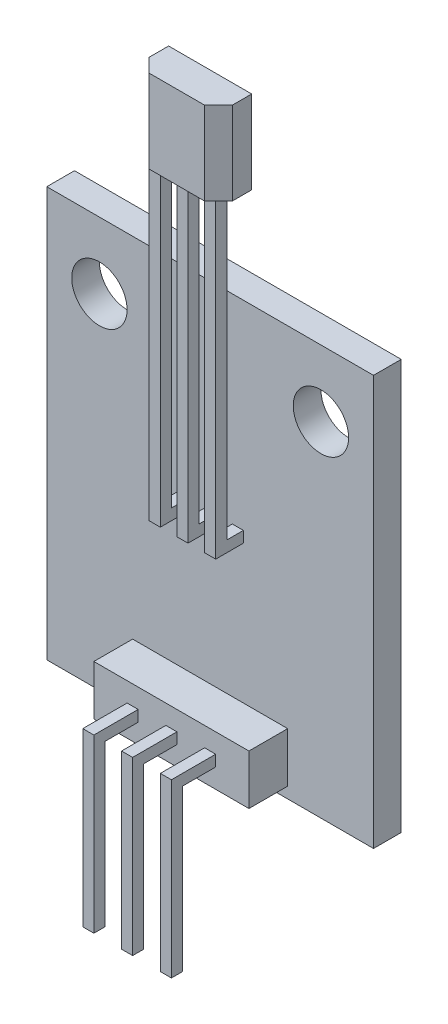
from build123d import *

# Parameters (mm, degrees)
SKETCH1_W               = 14.986
SKETCH1_H               = 18.796
BOSS_EXTRUDE1_DEPTH     = 0.635
SKETCH2_W               = 7.112
SKETCH2_H               = 2.286
BOSS_EXTRUDE2_DEPTH     = 1.778
SKETCH3_W               = 0.508
SKETCH3_H               = 0.508
BOSS_EXTRUDE3_DEPTH     = 2.032
SKETCH4_W               = 0.508
SKETCH4_H               = 0.508
BOSS_EXTRUDE4_DEPTH     = 7.366
CUT_EXTRUDE1_DEPTH      = 18.515873886
CUT_EXTRUDE1_DEPTH_BACK = 18.515873886
SKETCH5_R               = 1.27
SKETCH6_W               = 0.508
SKETCH6_H               = 0.508
BOSS_EXTRUDE5_DEPTH     = 1.27
SKETCH7_W               = 0.508
SKETCH7_H               = 0.508
BOSS_EXTRUDE6_DEPTH     = 13.716
LPATTERN1_COUNT         = 2
LPATTERN1_PITCH         = 1.27
MIRROR1_COPY_1_SKETCH_W = 0.508
MIRROR1_COPY_1_SKETCH_H = 0.508
MIRROR1_COPY_1_DEPTH    = 1.27
MIRROR1_COPY_2_SKETCH_W = 0.508
MIRROR1_COPY_2_SKETCH_H = 0.508
MIRROR1_COPY_2_DEPTH    = 13.716
MIRROR1_COPY_3_SKETCH_W = 0.508
MIRROR1_COPY_3_SKETCH_H = 0.508
MIRROR1_COPY_3_DEPTH    = 1.27
MIRROR1_COPY_4_SKETCH_W = 0.508
MIRROR1_COPY_4_SKETCH_H = 0.508
MIRROR1_COPY_4_DEPTH    = 13.716
SKETCH8_W               = 3.81
SKETCH8_H               = 1.524
BOSS_EXTRUDE7_DEPTH     = 3.81
CHAMFER1_SIZE           = 0.635


with BuildPart() as part:
    # Sketch1 → Boss-Extrude1 (new, symmetric)
    with BuildSketch(Plane.XY):
        Rectangle(SKETCH1_W, SKETCH1_H)
    extrude(amount=BOSS_EXTRUDE1_DEPTH, both=True)

    # Sketch2 → Boss-Extrude2 (add)
    with BuildSketch(Plane.XY.offset(0.635)):
        with Locations((0, -7.747)):
            Rectangle(SKETCH2_W, SKETCH2_H)
    extrude(amount=BOSS_EXTRUDE2_DEPTH)

    # Sketch3 → Boss-Extrude3 (add)
    with BuildSketch(Plane.XY.offset(2.413)):
        with Locations((-1.778, -7.747)):
            Rectangle(SKETCH3_W, SKETCH3_H)
        with Locations((0, -7.747)):
            Rectangle(SKETCH3_W, SKETCH3_H)
        with Locations((1.778, -7.747)):
            Rectangle(SKETCH3_W, SKETCH3_H)
    extrude(amount=BOSS_EXTRUDE3_DEPTH)

    # Sketch4 → Boss-Extrude4 (add)
    with BuildSketch(Plane.XZ.offset(8.001)):
        with Locations((-1.778, 4.191)):
            Rectangle(SKETCH4_W, SKETCH4_H)
        with Locations((0, 4.191)):
            Rectangle(SKETCH4_W, SKETCH4_H)
        with Locations((1.778, 4.191)):
            Rectangle(SKETCH4_W, SKETCH4_H)
    extrude(amount=BOSS_EXTRUDE4_DEPTH)

    # Sketch5 → Cut-Extrude1 (cut, two sides: drawn at the far end of the back side and taken through both)
    with BuildSketch(Plane.XY.offset(0.635).offset(-CUT_EXTRUDE1_DEPTH_BACK)):
        with Locations((-5.08, 6.35)):
            Circle(SKETCH5_R)
        with Locations((5.08, 6.35)):
            Circle(SKETCH5_R)
    extrude(amount=CUT_EXTRUDE1_DEPTH + CUT_EXTRUDE1_DEPTH_BACK, mode=Mode.SUBTRACT)

    # Sketch6 → Boss-Extrude5 (add)
    with BuildSketch(Plane.XY.offset(0.635)):
        Rectangle(SKETCH6_W, SKETCH6_H)
    boss_extrude5 = extrude(amount=BOSS_EXTRUDE5_DEPTH)

    # Sketch7 → Boss-Extrude6 (add)
    with BuildSketch(Plane(origin=(0, 0.254, 0), x_dir=(1, 0, 0), z_dir=(0, 1, 0))):
        with Locations((0, -1.651)):
            Rectangle(SKETCH7_W, SKETCH7_H)
    boss_extrude6 = extrude(amount=BOSS_EXTRUDE6_DEPTH)

    # LPattern1: Boss-Extrude5, Boss-Extrude6 ×2
    with Locations(*[(i * LPATTERN1_PITCH, 0, 0) for i in range(1, LPATTERN1_COUNT)]):
        add(boss_extrude5)
        add(boss_extrude6)

    # Mirror1 copy 1 sketch → Mirror1 copy 1 (add)
    with BuildSketch(Plane(origin=(-1.27, 0, 0.635), x_dir=(-1, 0, 0), z_dir=(0, 0, 1))):
        Rectangle(MIRROR1_COPY_1_SKETCH_W, MIRROR1_COPY_1_SKETCH_H)
    extrude(amount=MIRROR1_COPY_1_DEPTH)

    # Mirror1 copy 2 sketch → Mirror1 copy 2 (add)
    with BuildSketch(Plane(origin=(-1.27, 0.254, 0), x_dir=(-1, 0, 0), z_dir=(0, 1, 0))):
        with Locations((0, 1.651)):
            Rectangle(MIRROR1_COPY_2_SKETCH_W, MIRROR1_COPY_2_SKETCH_H)
    extrude(amount=MIRROR1_COPY_2_DEPTH)

    # Mirror1 copy 3 sketch → Mirror1 copy 3 (add)
    with BuildSketch(Plane(origin=(0, 0, 0.635), x_dir=(-1, 0, 0), z_dir=(0, 0, 1))):
        Rectangle(MIRROR1_COPY_3_SKETCH_W, MIRROR1_COPY_3_SKETCH_H)
    extrude(amount=MIRROR1_COPY_3_DEPTH)

    # Mirror1 copy 4 sketch → Mirror1 copy 4 (add)
    with BuildSketch(Plane(origin=(0, 0.254, 0), x_dir=(-1, 0, 0), z_dir=(0, 1, 0))):
        with Locations((0, 1.651)):
            Rectangle(MIRROR1_COPY_4_SKETCH_W, MIRROR1_COPY_4_SKETCH_H)
    extrude(amount=MIRROR1_COPY_4_DEPTH)

    # Sketch8 → Boss-Extrude7 (add)
    with BuildSketch(Plane(origin=(0, 13.97, 0), x_dir=(1, 0, 0), z_dir=(0, 1, 0))):
        with Locations((0, -1.397)):
            Rectangle(SKETCH8_W, SKETCH8_H)
    extrude(amount=BOSS_EXTRUDE7_DEPTH)

    # Chamfer1
    chamfer1_edges = [part.edges().sort_by_distance(p)[0] for p in [
        (1.905, 15.875, 2.159),
        (-1.905, 15.875, 2.159),
    ]]
    chamfer(chamfer1_edges, length=CHAMFER1_SIZE - 0.0001)  # a hair under: the kernel refuses the full size


solid = part.part
